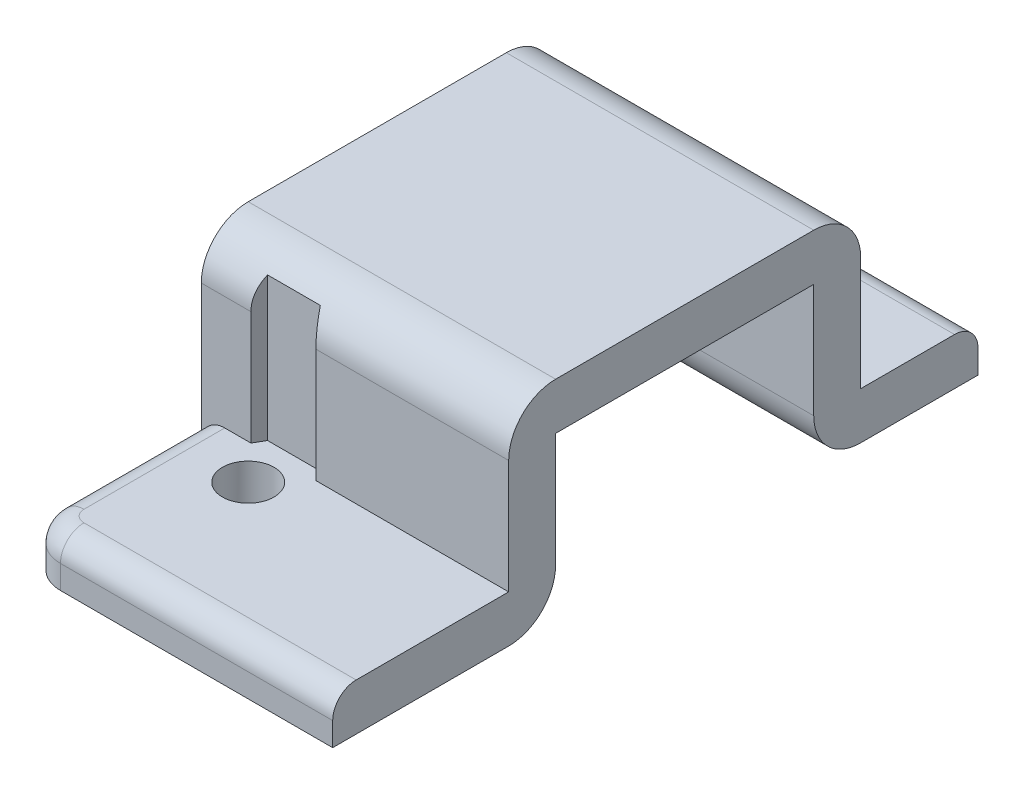
from build123d import *

# Parameters (mm, degrees)
BOSS_EXTRUDE1_DEPTH = 6.55
CUT_EXTRUDE1_REACH  = 19.743
SKETCH2_R           = 1.1
CUT_EXTRUDE2_REACH  = 19.743
FILLET1_R           = 2
FILLET3_R           = 1.5
FILLET4_R           = 1


with BuildPart() as part:
    # Sketch1 → Boss-Extrude1 (new, symmetric)
    with BuildSketch(Plane(origin=(0, 0, 0), x_dir=(0, 0, -1), z_dir=(1, 0, 0))):
        Polygon((-5.5, 6.85), (5.5, 6.85), (5.5, 0), (12.5, 0), (12.5, 2), (7.5, 2), (7.5, 8.85), (-7.5, 8.85), (-7.5, 2), (-15, 2), (-15, 0), (-5.5, 0), align=None)
    extrude(amount=BOSS_EXTRUDE1_DEPTH, both=True)

    # Sketch2 → Cut-Extrude1 (cut, up to next)
    with BuildSketch(Plane(origin=(0, 2, 0), x_dir=(1, 0, 0), z_dir=(0, 1, 0)), mode=Mode.PRIVATE) as cut_extrude1_sk1:
        with Locations(Location((-3.05, -9, 0), (0, 0, 270))):
            Circle(SKETCH2_R)
    cut_extrude1_tool1 = extrude(cut_extrude1_sk1.sketch, amount=-CUT_EXTRUDE1_REACH, mode=Mode.PRIVATE) & part.part
    cut_extrude1 = cut_extrude1_tool1.solids().sort_by_distance((-3.05, 2, 9))[0]
    add(cut_extrude1, mode=Mode.SUBTRACT)

    # Sketch3 → Cut-Extrude2 (cut, up to next)
    with BuildSketch(Plane(origin=(0, 2, 0), x_dir=(1, 0, 0), z_dir=(0, 1, 0)), mode=Mode.PRIVATE) as cut_extrude2_sk1:
        Polygon((-5.3, -9), (-4.175, -10.948557159), (-1.925, -10.948557159), (-0.8, -9), (-1.925, -7.051442841), (-4.175, -7.051442841), align=None)
    cut_extrude2_tool1 = extrude(cut_extrude2_sk1.sketch, amount=CUT_EXTRUDE2_REACH, mode=Mode.PRIVATE) & part.part
    cut_extrude2 = cut_extrude2_tool1.solids().sort_by_distance((-3.05, 2, 9))[0]
    add(cut_extrude2, mode=Mode.SUBTRACT)

    # Mirror1: Cut-Extrude1, Cut-Extrude2 across plane
    add(cut_extrude1.mirror(Plane.XY), mode=Mode.SUBTRACT)
    add(cut_extrude2.mirror(Plane.XY), mode=Mode.SUBTRACT)

    # Fillet1
    # the kernel refuses this fillet: 2 mm, written as the material it takes off along each edge
    with BuildSketch(Plane(origin=(-11.55, 0, -5.5), x_dir=(0, 1, 0), z_dir=(1, 0, 0)), Plane(origin=(11.55, 0, 5.5), x_dir=(0, 1, 0), z_dir=(-1, 0, 0))) as fillet1_piece_1:
        with BuildLine():
            CenterArc((FILLET1_R, -FILLET1_R), FILLET1_R, 90, 90)
            Line((0, -FILLET1_R), (0, 0))
            Line((0, 0), (FILLET1_R, 0))
        make_face()
    extrude(amount=23.1, mode=Mode.SUBTRACT)
    with BuildSketch(Plane(origin=(-6.666025404, 8.85, 7.5), x_dir=(0, 0, -1), z_dir=(1, 0, 0))) as fillet1_piece_2:
        with BuildLine():
            CenterArc((FILLET1_R, -FILLET1_R), FILLET1_R, 90, 90)
            Line((0, -FILLET1_R), (0, 0))
            Line((0, 0), (FILLET1_R, 0))
        make_face()
    extrude(amount=18.216025404, mode=Mode.SUBTRACT)
    with BuildSketch(Plane(origin=(-6.666025404, 8.85, -7.5), x_dir=(0, 0, 1), z_dir=(1, 0, 0))) as fillet1_piece_3:
        with BuildLine():
            CenterArc((FILLET1_R, FILLET1_R), FILLET1_R, 180, 90)
            Line((0, FILLET1_R), (0, 0))
            Line((0, 0), (FILLET1_R, 0))
        make_face()
    extrude(amount=18.216025404, mode=Mode.SUBTRACT)

    # Fillet3
    fillet3_edges = [part.edges().sort_by_distance(p)[0] for p in [
        (-6.55, 1, -12.5),
        (-6.55, 1, 15),
    ]]
    fillet(fillet3_edges, radius=FILLET3_R)

    # Fillet4
    fillet4_edges = [part.edges().sort_by_distance(p)[0] for p in [
        (-6.110660172, 2, 14.560660172),
        (-6.110660172, 2, -12.060660172),
        (-6.55, 2, 10.5),
        (-6.55, 2, -9.25),
        (0.75, 2, -12.5),
        (0.75, 2, 15),
    ]]
    fillet(fillet4_edges, radius=FILLET4_R)


solid = part.part
